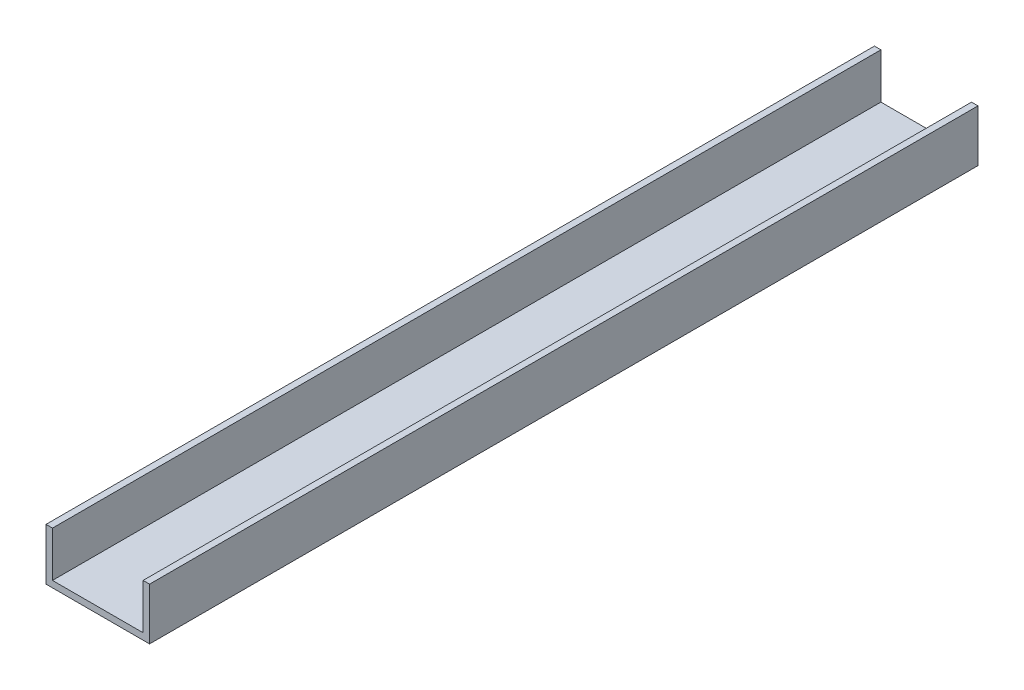
from build123d import *

# Parameters (mm, degrees)
BOSS_EXTRUDE1_DEPTH = 406.4


with BuildPart() as part:
    # Sketch1 → Boss-Extrude1 (new body)
    with BuildSketch(Plane.XY):
        Polygon((3.175, 3.175), (3.175, 25.4), (0, 25.4), (0, 0), (50.8, 0), (50.8, 25.4), (47.625, 25.4), (47.625, 3.175), align=None)
    extrude(amount=BOSS_EXTRUDE1_DEPTH)


solid = part.part
